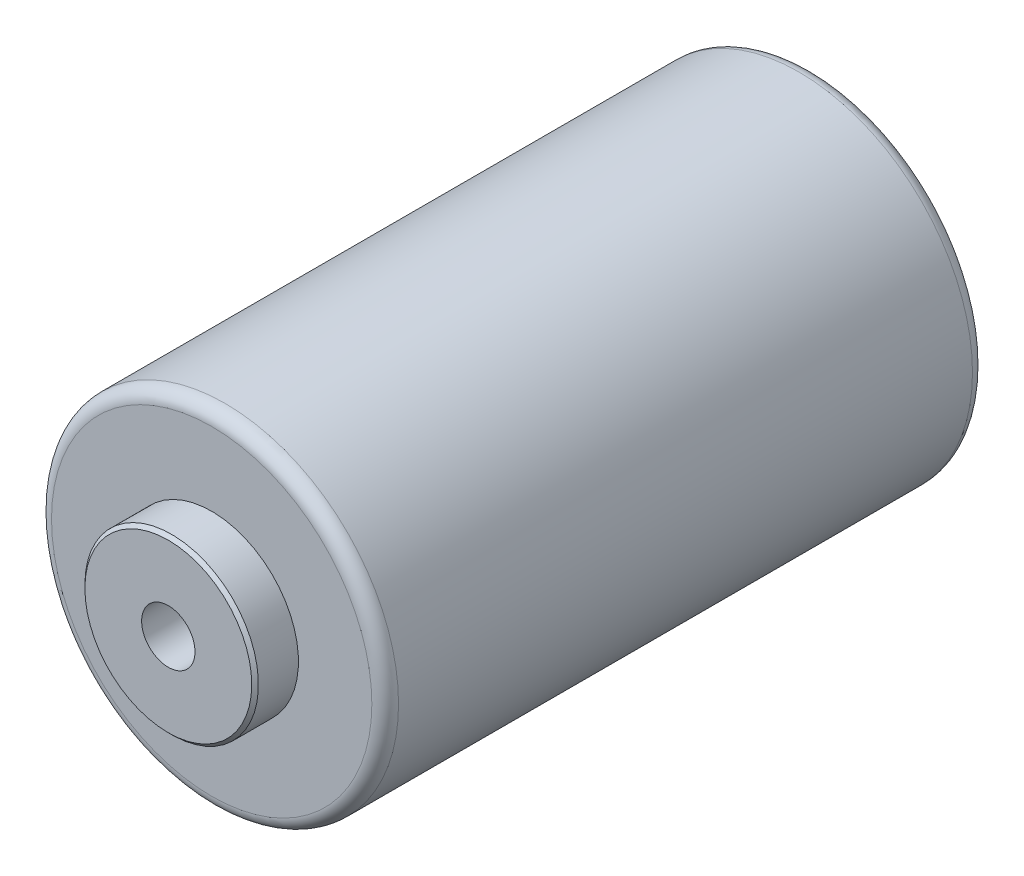
from build123d import *

# Parameters (mm, degrees)
SKICA1_R                 = 26
P_IDAT_VYSUNUT_M1_DEPTH  = 90
ZAOBLIT1_R               = 2
SKICA2_R                 = 13
P_IDAT_VYSUNUT_M2_DEPTH  = 6.5
SKICA4_R                 = 1.6
ODEBRAT_VYSUNUT_M1_DEPTH = 10
P_IDAT_START             = 6.5
SKICA5_R                 = 13
P_IDAT_VYSUNUT_M4_DEPTH  = 6.5
ZKOSEN_1_SIZE            = 0.5
SKICA8_R                 = 4
ODEBRAT_VYSUNUT_M3_DEPTH = 110.366356801


with BuildPart() as part:
    # Skica1 → Přidat vysunutím1 (new body)
    with BuildSketch(Plane.XY):
        Circle(SKICA1_R)
    extrude(amount=P_IDAT_VYSUNUT_M1_DEPTH)

    # Zaoblit1
    zaoblit1_edges = [part.edges().sort_by_distance(p)[0] for p in [
        (-26, 0, 0),
        (-26, 0, 90),
    ]]
    fillet(zaoblit1_edges, radius=ZAOBLIT1_R)

    # Skica2 → Přidat vysunutím2 (add)
    with BuildSketch(Plane(origin=(0, 0, 0), x_dir=(-1, 0, 0), z_dir=(0, 0, -1))):
        Circle(SKICA2_R)
    extrude(amount=P_IDAT_VYSUNUT_M2_DEPTH)

    # Skica4 → Odebrat vysunutím1 (cut)
    with BuildSketch(Plane(origin=(0, 0, 0), x_dir=(-1, 0, 0), z_dir=(0, 0, -1))):
        with Locations((-17.5, 0)):
            Circle(SKICA4_R)
        with Locations((0, 17.5)):
            Circle(SKICA4_R)
        with Locations((17.5, 0)):
            Circle(SKICA4_R)
        with Locations((0, -17.5)):
            Circle(SKICA4_R)
    extrude(amount=-ODEBRAT_VYSUNUT_M1_DEPTH, mode=Mode.SUBTRACT)

    # Skica5 → Přidat vysunutím4 (add)
    with BuildSketch(Plane.XY.offset(90).offset(P_IDAT_START)):
        Circle(SKICA5_R)
    extrude(amount=-P_IDAT_VYSUNUT_M4_DEPTH)

    # Zkosení1
    zkosen_1_edges = [part.edges().sort_by_distance(p)[0] for p in [
        (13, 0, -6.5),
        (-13, 0, 96.5),
    ]]
    chamfer(zkosen_1_edges, length=ZKOSEN_1_SIZE)

    # Skica8 → Odebrat vysunutím3 (cut, through all)
    with BuildSketch(Plane(origin=(0, 0, -6.5), x_dir=(-1, 0, 0), z_dir=(0, 0, -1))):
        Circle(SKICA8_R)
    extrude(amount=-ODEBRAT_VYSUNUT_M3_DEPTH, mode=Mode.SUBTRACT)


solid = part.part
